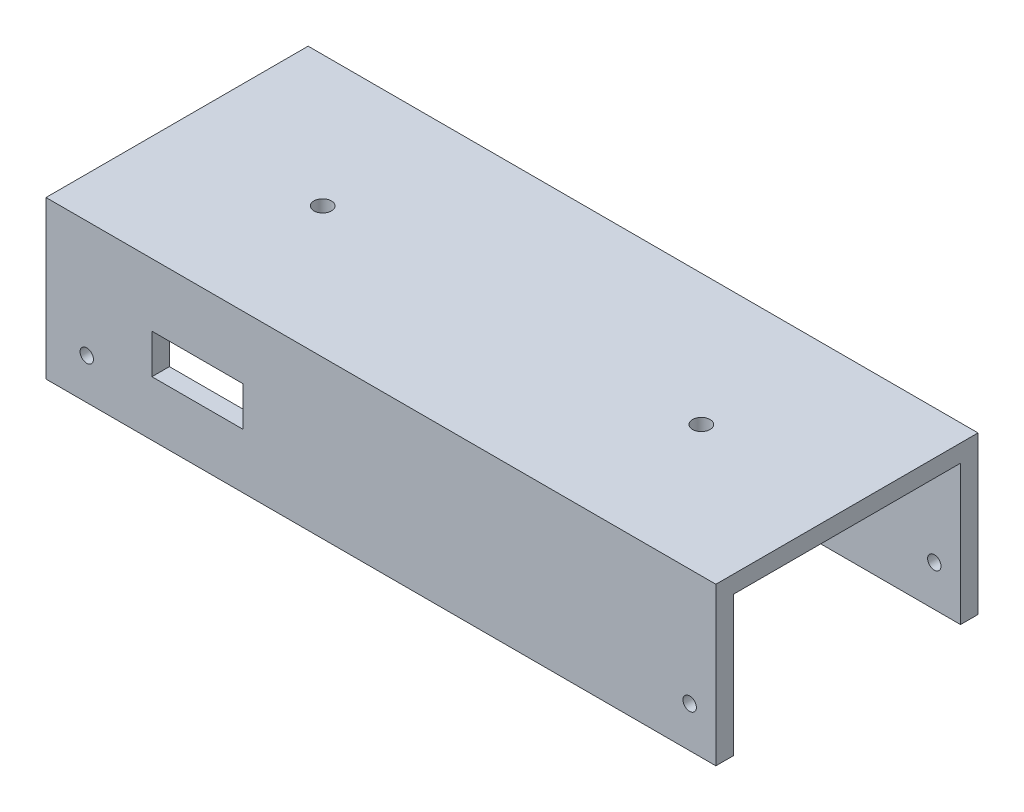
from build123d import *

# Parameters (mm, degrees)
SKETCH1_W           = 115
SKETCH1_H           = 27
BOSS_EXTRUDE5_DEPTH = 45
SHELL9_T            = -3
SKETCH3_R           = 1.15
CUT_EXTRUDE2_DEPTH  = 79
CUT_EXTRUDE8_DEPTH  = 23
SKETCH7_W           = 15.603868878
SKETCH7_H           = 6.773772537
CUT_EXTRUDE9_DEPTH  = 20
CUT_EXTRUDE10_DEPTH = 1
SKETCH10_R          = 1.5
CUT_EXTRUDE11_DEPTH = 26


with BuildPart() as part:
    # Sketch1 → Boss-Extrude5 (new body)
    with BuildSketch(Plane.XY):
        with Locations((57.5, 13.5)):
            Rectangle(SKETCH1_W, SKETCH1_H)
    extrude(amount=BOSS_EXTRUDE5_DEPTH)

    # Shell9
    shell9_openings = [part.faces().sort_by_distance(p)[0] for p in [
        (115, 13.5, 22.5),
        (57.5, 0, 22.5),
        (0, 13.5, 22.5),
    ]]
    offset(amount=SHELL9_T, openings=shell9_openings, kind=Kind.INTERSECTION)

    # Sketch3 → Cut-Extrude2 (cut)
    with BuildSketch(Plane(origin=(0, 0, 0), x_dir=(-1, 0, 0), z_dir=(0, 0, -1))):
        with Locations((-7, 7)):
            Circle(SKETCH3_R)
        with Locations((-110.5, 7)):
            Circle(SKETCH3_R)
    extrude(amount=-CUT_EXTRUDE2_DEPTH, mode=Mode.SUBTRACT)

    # Sketch6 → Cut-Extrude8 (cut)
    with BuildSketch(Plane(origin=(0, 0, 0), x_dir=(-1, 0, 0), z_dir=(0, 0, -1))):
        with BuildLine():
            Line((-46.883496676, 21.743762355), (-71.973496676, 21.743762355))
            ThreePointArc((-71.973496676, 21.743762355), (-73.723496676, 19.993762355), (-71.973496676, 18.243762355))
            Line((-71.973496676, 18.243762355), (-46.883496676, 18.243762355))
            ThreePointArc((-46.883496676, 18.243762355), (-45.133496676, 19.993762355), (-46.883496676, 21.743762355))
        make_face()
        with BuildLine():
            Line((-14.873496676, 15.993762355), (-89.873496676, 15.993762355))
            ThreePointArc((-89.873496676, 15.993762355), (-94.373496676, 11.493762355), (-89.873496676, 6.993762355))
            Line((-89.873496676, 6.993762355), (-14.873496676, 6.993762355))
            ThreePointArc((-14.873496676, 6.993762355), (-10.373496676, 11.493762355), (-14.873496676, 15.993762355))
        make_face()
        with BuildLine():
            ThreePointArc((-71.973496676, 4.743762355), (-73.723496676, 2.993762355), (-71.973496676, 1.243762355))
            Line((-71.973496676, 1.243762355), (-46.883496676, 1.243762355))
            ThreePointArc((-46.883496676, 1.243762355), (-45.133496676, 2.993762355), (-46.883496676, 4.743762355))
            Line((-46.883496676, 4.743762355), (-71.973496676, 4.743762355))
        make_face()
    extrude(amount=-CUT_EXTRUDE8_DEPTH, mode=Mode.SUBTRACT)

    # Sketch7 → Cut-Extrude9 (cut)
    with BuildSketch(Plane.XY.offset(45)):
        with Locations((25.989861683, 12.834718769)):
            Rectangle(SKETCH7_W, SKETCH7_H)
    extrude(amount=-CUT_EXTRUDE9_DEPTH, mode=Mode.SUBTRACT)

    # Sketch9 → Cut-Extrude10 (cut)
    # profile 1 of 6: a face of its own
    with BuildSketch(Plane.XZ.offset(-24)):
        with BuildLine():
            Line((2.360897436, 22.428821238), (2.645833333, 22.428821238))
            Line((2.645833333, 22.428821238), (2.645833333, 20.587550205))
            add(Edge.make_bspline(
                [(2.645833333, 20.587550205), (2.645582016, 20.54832753), (2.645096913, 20.472618319), (2.641603532, 20.363145879), (2.634236918, 20.262030216), (2.625883329, 20.168810167), (2.613866664, 20.083917824), (2.599192388, 20.007099874), (2.582650022, 19.9382826), (2.568117397, 19.895896494), (2.561242989, 19.875846479)],
                knots=[0, 0, 0, 0, 1.307562039, 2.523909702, 3.650326591, 4.686913197, 5.643429486, 6.506965704, 7.293745905, 8, 8, 8, 8], degree=3))
            add(Edge.make_bspline(
                [(2.561242989, 19.875846479), (2.551092751, 19.849784336), (2.53109576, 19.79843929), (2.493643793, 19.725655299), (2.451703037, 19.657123932), (2.403799771, 19.593227101), (2.350150613, 19.534285573), (2.292019545, 19.479018802), (2.228274443, 19.428596022), (2.158951754, 19.383887216), (2.085649501, 19.343621817), (2.008409823, 19.308745288), (1.927668268, 19.278367937), (1.842666359, 19.255614258), (1.754736789, 19.235897762), (1.662845548, 19.223066511), (1.567529511, 19.214333394), (1.502718345, 19.213525826), (1.469836739, 19.21311611)],
                knots=[0, 0, 0, 0, 0.981931301, 1.934503488, 2.87077864, 3.801706999, 4.735015492, 5.667491629, 6.616593066, 7.585388521, 8.561939025, 9.551802639, 10.560317337, 11.588439944, 12.640189604, 13.723962949, 14.845264515, 16, 16, 16, 16], degree=3))
            add(Edge.make_bspline(
                [(1.469836739, 19.21311611), (1.42186273, 19.213893065), (1.3281566, 19.215410667), (1.191536357, 19.233091711), (1.061783432, 19.258087464), (0.940612318, 19.295920245), (0.82878873, 19.342218085), (0.727076357, 19.395372079), (0.636388281, 19.45632238), (0.554633235, 19.525719354), (0.480844793, 19.608236408), (0.411423608, 19.705481074), (0.344602611, 19.818934609), (0.305442489, 19.902203713), (0.284935897, 19.945808418)],
                knots=[0, 0, 0, 0, 1.157897085, 2.2616841, 3.32207898, 4.345638746, 5.321241055, 6.241986252, 7.112515963, 7.955008012, 8.825025602, 9.77857164, 10.836726669, 12, 12, 12, 12], degree=3))
            Line((0.284935897, 19.945808418), (0.569871795, 19.945808418))
            add(Edge.make_bspline(
                [(0.569871795, 19.945808418), (0.592788228, 19.909426659), (0.637587032, 19.838304801), (0.721360297, 19.746217866), (0.813168893, 19.667520171), (0.916111177, 19.604101112), (1.030615479, 19.556285801), (1.156750687, 19.522199639), (1.295543201, 19.501792312), (1.392170438, 19.499332781), (1.442487981, 19.498052008)],
                knots=[0, 0, 0, 0, 0.997731894, 1.950442991, 2.880492273, 3.800895997, 4.748200782, 5.754801363, 6.83083817, 8, 8, 8, 8], degree=3))
            add(Edge.make_bspline(
                [(1.442487981, 19.498052008), (1.492169374, 19.499349357), (1.587950128, 19.501850516), (1.725682688, 19.522208747), (1.851408096, 19.556293219), (1.964401993, 19.604016541), (2.063331154, 19.662482267), (2.14861346, 19.72779662), (2.217687559, 19.801439387), (2.264145036, 19.869277168), (2.293023582, 19.929714772), (2.311413397, 19.981741769), (2.326357641, 20.040572594), (2.338857922, 20.106010012), (2.349172965, 20.178147515), (2.355707008, 20.257150045), (2.360429423, 20.342838054), (2.360737824, 20.402249687), (2.360897436, 20.432997921)],
                knots=[0, 0, 0, 0, 1.570740765, 3.028230971, 4.391408896, 5.680370741, 6.894727393, 8.017376726, 9.065722033, 10.075533815, 10.603371122, 11.180248986, 11.817768598, 12.521299649, 13.286540596, 14.121245857, 15.027658897, 16, 16, 16, 16], degree=3))
            Line((2.360897436, 20.432997921), (2.360897436, 20.553205253))
            add(Edge.make_bspline(
                [(2.360897436, 20.553205253), (2.331976708, 20.518786618), (2.274643959, 20.450554761), (2.175631741, 20.361145277), (2.067484967, 20.28414143), (1.950387754, 20.220987383), (1.82720842, 20.170476376), (1.699281111, 20.135149548), (1.567752604, 20.112325924), (1.478623868, 20.109870002), (1.433583734, 20.108628931)],
                knots=[0, 0, 0, 0, 1.012485704, 2.007162095, 2.997754123, 3.998611389, 4.999708251, 5.992315798, 6.98544096, 8, 8, 8, 8], degree=3))
            add(Edge.make_bspline(
                [(1.433583734, 20.108628931), (1.407062261, 20.109096133), (1.35433317, 20.110025009), (1.275997077, 20.1181519), (1.198816965, 20.129943617), (1.122972834, 20.147253208), (1.048355242, 20.169470703), (0.975087498, 20.197244458), (0.902576371, 20.228645316), (0.832139905, 20.265632073), (0.764479629, 20.306782166), (0.700105882, 20.351358159), (0.63935585, 20.399126749), (0.582807749, 20.450558973), (0.530535754, 20.505580392), (0.481836817, 20.563604473), (0.437516224, 20.625441445), (0.396664506, 20.689963757), (0.361233728, 20.757601166), (0.330132905, 20.82688701), (0.303091517, 20.89767314), (0.281532902, 20.970196547), (0.265067249, 21.044411509), (0.252811543, 21.120196444), (0.24586017, 21.197784725), (0.244776203, 21.25005552), (0.244230769, 21.276357296)],
                knots=[0, 0, 0, 0, 1.028754217, 2.045334182, 3.052854819, 4.056607503, 5.061168794, 6.071104265, 7.095078842, 8.125279047, 9.155117945, 10.165957491, 11.161587969, 12.151493252, 13.128948131, 14.104219989, 15.088194871, 16.07871515, 17.064853787, 18.047899887, 19.02414258, 20.002704429, 20.980574569, 21.971845993, 22.979467364, 24, 24, 24, 24], degree=3))
            add(Edge.make_bspline(
                [(0.244230769, 21.276357296), (0.244701727, 21.302667247), (0.245641819, 21.355185248), (0.253761636, 21.433090119), (0.265344208, 21.509951821), (0.283675541, 21.584978107), (0.305739544, 21.659023417), (0.333065927, 21.731540831), (0.365921516, 21.802552436), (0.403123218, 21.872110818), (0.444928073, 21.939282583), (0.490768252, 22.003078897), (0.540699095, 22.06303031), (0.594031762, 22.119741636), (0.651417453, 22.172665705), (0.712826482, 22.221674066), (0.777653523, 22.267588218), (0.846099493, 22.309417788), (0.917108266, 22.346413112), (0.988875801, 22.380170253), (1.062352772, 22.406961919), (1.136169289, 22.430568587), (1.211625355, 22.447291943), (1.287795776, 22.460193548), (1.364941326, 22.468053688), (1.416605737, 22.46903484), (1.442487981, 22.469526366)],
                knots=[0, 0, 0, 0, 1.008818848, 2.013730394, 3.001654427, 3.987803273, 4.973046549, 5.963777569, 6.957074694, 7.972068341, 8.987420212, 9.989399531, 10.982630087, 11.977756091, 12.973280677, 13.973972381, 14.989194003, 16.018387222, 17.047741039, 18.059210846, 19.057554164, 20.045176975, 21.029480261, 22.018708529, 23.007435371, 24, 24, 24, 24], degree=3))
            add(Edge.make_bspline(
                [(1.442487981, 22.469526366), (1.485169904, 22.46829567), (1.569453588, 22.465865423), (1.69348814, 22.446796241), (1.8131786, 22.416394243), (1.929200372, 22.372837207), (2.042498569, 22.313373958), (2.152699785, 22.235048569), (2.260122857, 22.137158475), (2.326414889, 22.062089805), (2.360897436, 22.023041991)],
                knots=[0, 0, 0, 0, 0.96728863, 1.910097829, 2.838038873, 3.762875196, 4.71315279, 5.730631239, 6.819562287, 8, 8, 8, 8], degree=3))
            Line((2.360897436, 22.023041991), (2.360897436, 22.428821238))
        make_face()
        with BuildLine():
            add(Edge.make_bspline(
                [(1.465384615, 22.184590469), (1.423718905, 22.18317436), (1.341229635, 22.180370763), (1.220318067, 22.156436059), (1.103589706, 22.118929421), (0.99327621, 22.06527862), (0.889946189, 21.999878847), (0.798256888, 21.920648729), (0.718060999, 21.830164679), (0.650222191, 21.729244812), (0.596218737, 21.620367462), (0.557988635, 21.505604153), (0.533268971, 21.386809267), (0.530540601, 21.305735549), (0.529166667, 21.264908979)],
                knots=[0, 0, 0, 0, 1.026226791, 2.031711442, 3.026614839, 4.04107745, 5.047145931, 6.032893242, 7.017642609, 8.019221815, 9.021877557, 10.003543541, 10.994637589, 12, 12, 12, 12], degree=3))
            add(Edge.make_bspline(
                [(0.529166667, 21.264908979), (0.529825032, 21.234126653), (0.531119843, 21.17358682), (0.543569089, 21.084743158), (0.563690393, 21.000124588), (0.59220843, 20.919725991), (0.627544089, 20.843086213), (0.671987169, 20.770733193), (0.724284836, 20.702602495), (0.784027757, 20.639198034), (0.849864903, 20.581448441), (0.921274462, 20.530704647), (0.998159582, 20.489202207), (1.078629331, 20.453333019), (1.164636231, 20.427135579), (1.254941473, 20.407143258), (1.350183941, 20.395705313), (1.415109733, 20.394287632), (1.448212139, 20.393564828)],
                knots=[0, 0, 0, 0, 1.039728707, 2.044842319, 3.024901384, 3.974314358, 4.923051295, 5.871625912, 6.837440708, 7.820715446, 8.810779094, 9.792721783, 10.773906224, 11.758876063, 12.764959493, 13.806266761, 14.881525401, 16, 16, 16, 16], degree=3))
            add(Edge.make_bspline(
                [(1.448212139, 20.393564828), (1.481743549, 20.394261159), (1.547313864, 20.395622827), (1.643081785, 20.407328144), (1.733825771, 20.426216651), (1.819462617, 20.453034538), (1.900315662, 20.487253555), (1.975476634, 20.530557486), (2.046557126, 20.579873792), (2.111287583, 20.637397548), (2.169820219, 20.700793222), (2.220829558, 20.769776806), (2.264294808, 20.843310276), (2.300288123, 20.921385346), (2.327766572, 21.004608766), (2.346198722, 21.092772489), (2.359086269, 21.185454131), (2.360284536, 21.248961947), (2.360897436, 21.281445437)],
                knots=[0, 0, 0, 0, 1.121943988, 2.193949579, 3.223793937, 4.220241907, 5.192961521, 6.155822191, 7.11847367, 8.083710714, 9.04790392, 10.001595906, 10.949595423, 11.902125208, 12.873731292, 13.87582262, 14.913508608, 16, 16, 16, 16], degree=3))
            add(Edge.make_bspline(
                [(2.360897436, 21.281445437), (2.359682256, 21.32373449), (2.357308222, 21.40635244), (2.334904372, 21.526736436), (2.298781753, 21.639919448), (2.24812077, 21.745543511), (2.184637091, 21.84248946), (2.10817325, 21.928961805), (2.020047922, 22.005071868), (1.920514302, 22.068479514), (1.813428406, 22.11970173), (1.701377035, 22.158129909), (1.584526545, 22.179896181), (1.505327159, 22.1830167), (1.465384615, 22.184590469)],
                knots=[0, 0, 0, 0, 1.070913519, 2.092188694, 3.091357305, 4.074328408, 5.051968682, 6.018948707, 6.99050112, 7.9935919, 9.000589572, 9.992915277, 10.987769056, 12, 12, 12, 12], degree=3))
        make_face(mode=Mode.SUBTRACT)
    # profile 2 of 6: a face of its own
    with BuildSketch(Plane.XZ.offset(-24)):
        with BuildLine():
            Line((3.215705128, 22.428821238), (3.500641026, 22.428821238))
            Line((3.500641026, 22.428821238), (3.500641026, 22.087279772))
            add(Edge.make_bspline(
                [(3.500641026, 22.087279772), (3.521676543, 22.119080416), (3.561906805, 22.179898901), (3.628774962, 22.260334624), (3.69726727, 22.326932559), (3.767711619, 22.380003609), (3.840626038, 22.419748366), (3.914410273, 22.448861334), (3.990225163, 22.46607647), (4.041172051, 22.468374861), (4.066696715, 22.469526366)],
                knots=[0, 0, 0, 0, 1.2804753, 2.448899062, 3.506932113, 4.484331642, 5.4025378, 6.288909075, 7.142734305, 8, 8, 8, 8], degree=3))
            add(Edge.make_bspline(
                [(4.066696715, 22.469526366), (4.086496311, 22.468446389), (4.127235267, 22.466224264), (4.188905188, 22.450611588), (4.252444605, 22.425685096), (4.293395199, 22.402244323), (4.31474359, 22.390024163)],
                knots=[0, 0, 0, 0, 0.901110191, 1.854092781, 2.881294221, 4, 4, 4, 4], degree=3))
            Line((4.31474359, 22.390024163), (4.158283253, 22.143249323))
            add(Edge.make_bspline(
                [(4.158283253, 22.143249323), (4.144577213, 22.149363707), (4.118560524, 22.160969979), (4.080501739, 22.174705946), (4.04541224, 22.182793955), (4.023057012, 22.184019249), (4.012635216, 22.184590469)],
                knots=[0, 0, 0, 0, 1.180555205, 2.24091978, 3.179933427, 4, 4, 4, 4], degree=3))
            add(Edge.make_bspline(
                [(4.012635216, 22.184590469), (3.989770015, 22.183066435), (3.943131633, 22.179957848), (3.874656408, 22.155520501), (3.808210729, 22.11603689), (3.755440721, 22.072248096), (3.714580963, 22.030022594), (3.685425187, 21.993148686), (3.658680124, 21.951802356), (3.63312571, 21.906690428), (3.609842714, 21.857042639), (3.588112407, 21.80335501), (3.568464724, 21.745565357), (3.557261289, 21.705304071), (3.551522436, 21.684680613)],
                knots=[0, 0, 0, 0, 1.125678352, 2.296057538, 3.5422874, 4.923748041, 5.663163013, 6.437101912, 7.23742474, 8.08941207, 8.991984279, 9.93940061, 10.944477711, 12, 12, 12, 12], degree=3))
            add(Edge.make_bspline(
                [(3.551522436, 21.684680613), (3.547229479, 21.66628632), (3.537720906, 21.625544358), (3.528475725, 21.557192482), (3.519341234, 21.476435306), (3.512903587, 21.38304804), (3.506936363, 21.277263894), (3.503570789, 21.158921715), (3.500755797, 21.027900032), (3.500680443, 20.936301869), (3.500641026, 20.888386543)],
                knots=[0, 0, 0, 0, 0.566838948, 1.255505196, 2.06880316, 3.007127437, 4.065329342, 5.249902469, 6.561414163, 8, 8, 8, 8], degree=3))
            Line((3.500641026, 20.888386543), (3.500641026, 20.108628931))
            Line((3.500641026, 20.108628931), (3.215705128, 20.108628931))
            Line((3.215705128, 20.108628931), (3.215705128, 22.428821238))
        make_face()
    # profile 3 of 6: a face of its own
    with BuildSketch(Plane.XZ.offset(-24)):
        with BuildLine():
            add(Edge.make_bspline(
                [(5.720342548, 22.469526366), (5.763877488, 22.468599365), (5.849238867, 22.466781742), (5.974250306, 22.447355309), (6.093580537, 22.417648772), (6.207686583, 22.376580997), (6.315107079, 22.321533799), (6.417406708, 22.255848228), (6.514304994, 22.178031161), (6.572383028, 22.117834913), (6.601862981, 22.087279772)],
                knots=[0, 0, 0, 0, 1.054011418, 2.066658804, 3.057071809, 4.030435133, 4.997543892, 5.974964718, 6.972108034, 8, 8, 8, 8], degree=3))
            add(Edge.make_bspline(
                [(6.601862981, 22.087279772), (6.627246611, 22.058057085), (6.677522627, 22.00017725), (6.741989386, 21.90632823), (6.797526087, 21.809136853), (6.842033202, 21.707312492), (6.877126045, 21.60174404), (6.902041355, 21.492068645), (6.916861289, 21.378528515), (6.918859694, 21.301417891), (6.919871795, 21.262364908)],
                knots=[0, 0, 0, 0, 1.025258237, 2.030674902, 3.01204498, 3.988269485, 4.97094183, 5.956517959, 6.965070386, 8, 8, 8, 8], degree=3))
            add(Edge.make_bspline(
                [(6.919871795, 21.262364908), (6.918981582, 21.22308557), (6.917222479, 21.145467766), (6.900582198, 21.031150199), (6.874700428, 20.920302038), (6.837660117, 20.813387366), (6.790163833, 20.710079373), (6.732205852, 20.610829281), (6.663379456, 20.515441275), (6.585361545, 20.424725322), (6.499135914, 20.341117398), (6.405594837, 20.268248182), (6.306576535, 20.205817228), (6.20076435, 20.155528479), (6.089124558, 20.115877537), (5.971416361, 20.088028236), (5.847822619, 20.071190138), (5.763433639, 20.069027896), (5.720342548, 20.067923802)],
                knots=[0, 0, 0, 0, 0.998656419, 1.973391657, 2.932242238, 3.890759089, 4.846373663, 5.82037756, 6.809684879, 7.83454468, 8.860553229, 9.859544525, 10.845671541, 11.83227036, 12.833544569, 13.85385346, 14.904124723, 16, 16, 16, 16], degree=3))
            add(Edge.make_bspline(
                [(5.720342548, 20.067923802), (5.677040338, 20.069031602), (5.592230773, 20.071201283), (5.468200775, 20.087962818), (5.35028162, 20.115864702), (5.238495677, 20.155658785), (5.132228566, 20.205818835), (5.03263653, 20.268059439), (4.939019464, 20.341139009), (4.852775592, 20.424719466), (4.774762571, 20.515442784), (4.705934914, 20.61082889), (4.647977261, 20.710079475), (4.60048089, 20.813387339), (4.563440603, 20.920302045), (4.537558826, 21.031150197), (4.520918547, 21.145467767), (4.519159444, 21.22308557), (4.518269231, 21.262364908)],
                knots=[0, 0, 0, 0, 1.099876186, 2.154163076, 3.173186993, 4.173200201, 5.163417411, 6.152872554, 7.150605724, 8.17532212, 9.198891216, 10.186952605, 11.159729845, 12.11414092, 13.071450619, 14.029093627, 15.002601286, 16, 16, 16, 16], degree=3))
            add(Edge.make_bspline(
                [(4.518269231, 21.262364908), (4.519288234, 21.301205632), (4.521305684, 21.37810359), (4.536110718, 21.491430281), (4.560928837, 21.600920055), (4.596063746, 21.706081022), (4.640981098, 21.807459168), (4.695737409, 21.904890693), (4.760861769, 21.998315341), (4.810937825, 22.056120371), (4.836278045, 22.085371719)],
                knots=[0, 0, 0, 0, 1.031353054, 2.041901799, 3.029428768, 4.008703097, 4.981709435, 5.96992636, 6.972712378, 8, 8, 8, 8], degree=3))
            add(Edge.make_bspline(
                [(4.836278045, 22.085371719), (4.865713552, 22.116191843), (4.923603658, 22.176805038), (5.020984289, 22.254395257), (5.123032255, 22.321447695), (5.231639867, 22.375401119), (5.345652174, 22.417890346), (5.465593915, 22.44743192), (5.591029561, 22.466711749), (5.676808646, 22.468578811), (5.720342548, 22.469526366)],
                knots=[0, 0, 0, 0, 1.027980169, 2.021703884, 2.998553061, 3.971491411, 4.943284454, 5.930300938, 6.949603206, 8, 8, 8, 8], degree=3))
        make_face()
        with BuildLine():
            add(Edge.make_bspline(
                [(5.719070513, 22.184590469), (5.688284251, 22.183715447), (5.62750647, 22.18198799), (5.538044418, 22.16884902), (5.451920136, 22.148032355), (5.368970227, 22.118455818), (5.289474421, 22.080266103), (5.213356606, 22.033359233), (5.140392892, 21.97835648), (5.072010592, 21.915343914), (5.009252352, 21.846510826), (4.954390187, 21.773169814), (4.907740269, 21.696510486), (4.868878125, 21.616453123), (4.839933747, 21.532186433), (4.818912506, 21.444664718), (4.80578593, 21.353709661), (4.804074715, 21.291877881), (4.803205128, 21.260456855)],
                knots=[0, 0, 0, 0, 1.021534396, 2.016698045, 2.994645724, 3.958388632, 4.93408049, 5.916473867, 6.921342795, 7.962252576, 8.998418191, 10.008913653, 10.997312074, 11.973003931, 12.956656626, 13.948281152, 14.957379055, 16, 16, 16, 16], degree=3))
            add(Edge.make_bspline(
                [(4.803205128, 21.260456855), (4.804662747, 21.219860373), (4.807555847, 21.139283948), (4.831082812, 21.020619573), (4.870440365, 20.906698893), (4.923587398, 20.798189743), (4.990177325, 20.697794176), (5.06863345, 20.608285044), (5.158113749, 20.531009343), (5.257551574, 20.466891719), (5.364915848, 20.415946798), (5.478541225, 20.379843442), (5.597050998, 20.356374121), (5.678041375, 20.354041426), (5.719070513, 20.3528597)],
                knots=[0, 0, 0, 0, 1.016792936, 2.018143844, 3.017858371, 4.030088057, 5.03801393, 6.028138512, 7.003788237, 7.991172063, 8.984598303, 9.972568034, 10.972917682, 12, 12, 12, 12], degree=3))
            add(Edge.make_bspline(
                [(5.719070513, 20.3528597), (5.76009729, 20.354048311), (5.84108301, 20.356394597), (5.95942812, 20.379725241), (6.072742937, 20.41610499), (6.179995696, 20.466834423), (6.279388258, 20.531252828), (6.369512103, 20.607848684), (6.447298344, 20.69803125), (6.513822399, 20.798322722), (6.567839802, 20.90653067), (6.607013135, 21.020640599), (6.630596659, 21.139278594), (6.633482125, 21.219858579), (6.634935897, 21.260456855)],
                knots=[0, 0, 0, 0, 1.02726834, 2.027799167, 3.010890988, 4.004497153, 4.992059811, 5.971914811, 6.958719428, 7.966827853, 8.981595046, 9.981490638, 10.983022906, 12, 12, 12, 12], degree=3))
            add(Edge.make_bspline(
                [(6.634935897, 21.260456855), (6.63406661, 21.291878068), (6.632355984, 21.353710219), (6.619225123, 21.444662587), (6.598219741, 21.53219425), (6.569216917, 21.616424282), (6.530523633, 21.696717768), (6.482974113, 21.772944734), (6.428335969, 21.846764887), (6.364820438, 21.915121404), (6.296509516, 21.978381044), (6.223516232, 22.033380562), (6.147511287, 22.080059952), (6.06824643, 22.11878247), (5.985285886, 22.147763272), (5.899282276, 22.168969216), (5.810201927, 22.181932466), (5.749641938, 22.183698801), (5.719070513, 22.184590469)],
                knots=[0, 0, 0, 0, 1.042956736, 2.052379634, 3.044323526, 4.02829302, 5.004299113, 5.996692471, 7.007513377, 8.048758398, 9.090003419, 10.095195979, 11.07790575, 12.047570684, 13.018257071, 13.989683339, 14.985167495, 16, 16, 16, 16], degree=3))
        make_face(mode=Mode.SUBTRACT)
    # profile 4 of 6: a face of its own
    with BuildSketch(Plane.XZ.offset(-24)):
        with BuildLine():
            Line((7.449038462, 22.428821238), (7.733974359, 22.428821238))
            Line((7.733974359, 22.428821238), (7.733974359, 21.352679411))
            add(Edge.make_bspline(
                [(7.733974359, 21.352679411), (7.734103087, 21.321090203), (7.734349338, 21.260661528), (7.736019334, 21.17370718), (7.739947348, 21.094407733), (7.74485846, 21.022717379), (7.751174112, 20.958648245), (7.758688303, 20.902424114), (7.767087014, 20.85340739), (7.77530819, 20.823885917), (7.779131611, 20.810156375)],
                knots=[0, 0, 0, 0, 1.388932606, 2.656963016, 3.823490214, 4.879454478, 5.816252168, 6.653371382, 7.373723809, 8, 8, 8, 8], degree=3))
            add(Edge.make_bspline(
                [(7.779131611, 20.810156375), (7.785265216, 20.792899913), (7.797404911, 20.758745748), (7.819424429, 20.70940715), (7.84666442, 20.663709572), (7.876472978, 20.619890878), (7.910853155, 20.579249075), (7.949369961, 20.541852797), (7.990734076, 20.506289086), (8.052197561, 20.464211453), (8.136252752, 20.419112547), (8.246609181, 20.380199911), (8.366265157, 20.35694456), (8.448964581, 20.354246486), (8.491471354, 20.3528597)],
                knots=[0, 0, 0, 0, 0.725840625, 1.436591201, 2.137033971, 2.831655856, 3.53531722, 4.242432219, 4.957935707, 5.694543706, 7.190802206, 8.724350549, 10.316345118, 12, 12, 12, 12], degree=3))
            add(Edge.make_bspline(
                [(8.491471354, 20.3528597), (8.533974179, 20.354275975), (8.616209281, 20.357016206), (8.734550575, 20.379498416), (8.842728643, 20.417059291), (8.939657721, 20.469498872), (9.024898161, 20.533672029), (9.095931455, 20.608972877), (9.154539465, 20.693019107), (9.180129439, 20.755724702), (9.192998798, 20.78725974)],
                knots=[0, 0, 0, 0, 1.157059328, 2.238695713, 3.266970494, 4.264342957, 5.228770407, 6.160125903, 7.074715775, 8, 8, 8, 8], degree=3))
            add(Edge.make_bspline(
                [(9.192998798, 20.78725974), (9.196803564, 20.799929168), (9.205214972, 20.827938179), (9.214252248, 20.875454094), (9.222393367, 20.932118414), (9.229344962, 20.998301932), (9.234302645, 21.073831691), (9.236975112, 21.158684089), (9.239994334, 21.252592751), (9.240040159, 21.318331362), (9.240064103, 21.352679411)],
                knots=[0, 0, 0, 0, 0.557542046, 1.232589297, 2.036731608, 2.971723315, 4.038036528, 5.22795436, 6.551621927, 8, 8, 8, 8], degree=3))
            Line((9.240064103, 21.352679411), (9.240064103, 22.428821238))
            Line((9.240064103, 22.428821238), (9.525, 22.428821238))
            Line((9.525, 22.428821238), (9.525, 21.299253931))
            add(Edge.make_bspline(
                [(9.525, 21.299253931), (9.52459932, 21.260875282), (9.523821945, 21.186415454), (9.518825998, 21.078207725), (9.510253849, 20.977367688), (9.497242985, 20.883841967), (9.481943409, 20.797701966), (9.462207361, 20.718837283), (9.438641388, 20.647490902), (9.4120571, 20.582410861), (9.38065012, 20.523404036), (9.347242751, 20.467400831), (9.308666708, 20.415790811), (9.26805371, 20.366004872), (9.222876494, 20.320519344), (9.173981622, 20.278290505), (9.122057291, 20.238672826), (9.065951233, 20.203211451), (9.006482518, 20.171264923), (8.943577734, 20.142947481), (8.8764664, 20.120538715), (8.806014386, 20.101206896), (8.731876522, 20.086044485), (8.65412428, 20.075352385), (8.572783849, 20.068797978), (8.517348839, 20.068220087), (8.488927284, 20.067923802)],
                knots=[0, 0, 0, 0, 1.493040784, 2.896703357, 4.213163133, 5.428574705, 6.569057535, 7.615249723, 8.588095153, 9.490268104, 10.346124644, 11.18633936, 12.024365274, 12.850166724, 13.684164916, 14.514361689, 15.362232829, 16.222528818, 17.093394965, 17.986930858, 18.902426812, 19.842810585, 20.827885679, 21.843828298, 22.894529745, 24, 24, 24, 24], degree=3))
            add(Edge.make_bspline(
                [(8.488927284, 20.067923802), (8.460718303, 20.068231965), (8.40528503, 20.068837534), (8.323940401, 20.075316174), (8.245972737, 20.086027872), (8.171659233, 20.101317962), (8.100925315, 20.120403404), (8.033484469, 20.143085182), (7.97012638, 20.171279619), (7.910089847, 20.203009261), (7.853844824, 20.238900618), (7.801132042, 20.278241625), (7.752022183, 20.320973554), (7.706504414, 20.366917942), (7.665217643, 20.416644734), (7.627647376, 20.469753921), (7.593215222, 20.525719273), (7.562052334, 20.585647999), (7.535280956, 20.651481179), (7.511645125, 20.724322117), (7.492313332, 20.8049694), (7.476581236, 20.893354078), (7.463925286, 20.989053152), (7.455138571, 21.092620214), (7.450225639, 21.203802992), (7.449442719, 21.280592535), (7.449038462, 21.320242512)],
                knots=[0, 0, 0, 0, 1.083640291, 2.129454052, 3.13281866, 4.105697902, 5.042300162, 5.946461698, 6.836384745, 7.703652036, 8.553297018, 9.397182691, 10.228592656, 11.052265423, 11.879314572, 12.708807002, 13.549817954, 14.402308542, 15.300838682, 16.27712199, 17.341985831, 18.484375296, 19.725102775, 21.0496083, 22.476576903, 24, 24, 24, 24], degree=3))
            Line((7.449038462, 21.320242512), (7.449038462, 22.428821238))
        make_face()
    # profile 5 of 6: a face of its own
    with BuildSketch(Plane.XZ.offset(-24)):
        with BuildLine():
            Line((10.176282051, 22.428821238), (10.461217949, 22.428821238))
            Line((10.461217949, 22.428821238), (10.461217949, 21.999509339))
            add(Edge.make_bspline(
                [(10.461217949, 21.999509339), (10.491477952, 22.038459998), (10.550282213, 22.114152808), (10.651632662, 22.212115282), (10.758609125, 22.294733593), (10.873964506, 22.359487748), (10.995905996, 22.408310913), (11.12393317, 22.444396557), (11.259132621, 22.465661323), (11.35156726, 22.468220973), (11.398707933, 22.469526366)],
                knots=[0, 0, 0, 0, 1.0828784, 2.104357462, 3.088488658, 4.04616522, 5.001424249, 5.969181776, 6.964304535, 8, 8, 8, 8], degree=3))
            add(Edge.make_bspline(
                [(11.398707933, 22.469526366), (11.439884601, 22.468335126), (11.52127245, 22.465980576), (11.641072665, 22.450039305), (11.756438906, 22.422718255), (11.866718497, 22.383347425), (11.973092849, 22.334674248), (12.073987183, 22.273245223), (12.170973051, 22.202119607), (12.261611308, 22.120266156), (12.345359977, 22.031703372), (12.41779187, 21.936433139), (12.480268526, 21.837588507), (12.530769438, 21.733637109), (12.570328439, 21.625397522), (12.598463182, 21.512432436), (12.615206902, 21.39516069), (12.617453397, 21.315420365), (12.618589744, 21.275085261)],
                knots=[0, 0, 0, 0, 1.041296284, 2.058176809, 3.050446431, 4.034000596, 5.01514041, 6.003636468, 7.015969324, 8.052561599, 9.08815499, 10.094063707, 11.074456064, 12.040834395, 13.011057502, 13.983766392, 14.980127149, 16, 16, 16, 16], degree=3))
            add(Edge.make_bspline(
                [(12.618589744, 21.275085261), (12.617478053, 21.233898881), (12.615285639, 21.152673396), (12.598281241, 21.033395815), (12.571106076, 20.918653697), (12.532046153, 20.808637894), (12.481571374, 20.703424153), (12.420153666, 20.603088351), (12.347685228, 20.507662635), (12.264862062, 20.418442504), (12.175006899, 20.336255984), (12.078960891, 20.264375735), (11.978214579, 20.204013202), (11.873283399, 20.153591517), (11.76326907, 20.115589322), (11.648684882, 20.08817746), (11.529593221, 20.07127331), (11.448584319, 20.069048867), (11.407612179, 20.067923802)],
                knots=[0, 0, 0, 0, 1.038740735, 2.04854663, 3.033179607, 4.009277356, 4.987731542, 5.972001279, 6.972200261, 8.005528982, 9.039189865, 10.040446548, 11.026516639, 11.997840187, 12.972163198, 13.956796175, 14.96660207, 16, 16, 16, 16], degree=3))
            add(Edge.make_bspline(
                [(11.407612179, 20.067923802), (11.361504311, 20.069098378), (11.270427752, 20.071418509), (11.137261294, 20.094931117), (11.009103007, 20.130071051), (10.887372759, 20.181505138), (10.771106243, 20.247051213), (10.660961133, 20.326979757), (10.556352365, 20.42112361), (10.493388706, 20.492544615), (10.461217949, 20.529036583)],
                knots=[0, 0, 0, 0, 1.014726462, 2.004382257, 2.969841629, 3.936926163, 4.907207904, 5.903978561, 6.929055279, 8, 8, 8, 8], degree=3))
            Line((10.461217949, 20.529036583), (10.461217949, 19.253821238))
            Line((10.461217949, 19.253821238), (10.176282051, 19.253821238))
            Line((10.176282051, 19.253821238), (10.176282051, 22.428821238))
        make_face()
        with BuildLine():
            add(Edge.make_bspline(
                [(11.396163862, 22.184590469), (11.363888116, 22.184009663), (11.300345492, 22.182866207), (11.207207122, 22.169282696), (11.117494841, 22.149563459), (11.032112785, 22.119707664), (10.950242583, 22.083060169), (10.872514805, 22.037265773), (10.798984011, 21.983152882), (10.729835205, 21.921758049), (10.66736636, 21.854108153), (10.612064276, 21.781910641), (10.565611935, 21.705256943), (10.52705653, 21.624861078), (10.497716553, 21.540092855), (10.476892435, 21.451435051), (10.463802044, 21.358790626), (10.462088508, 21.295693392), (10.461217949, 21.263636943)],
                knots=[0, 0, 0, 0, 1.05670511, 2.080379991, 3.077984906, 4.06214886, 5.038337365, 6.01289324, 7.01187578, 8.025460281, 9.038092164, 10.024533457, 11.000252242, 11.969694649, 12.940728589, 13.933144304, 14.949937299, 16, 16, 16, 16], degree=3))
            add(Edge.make_bspline(
                [(10.461217949, 21.263636943), (10.462661082, 21.221556298), (10.465488304, 21.139116751), (10.488472916, 21.018662583), (10.525879191, 20.904678582), (10.578973096, 20.798124641), (10.64605411, 20.700168783), (10.726878866, 20.61245659), (10.820716037, 20.535539411), (10.926005561, 20.470750131), (11.038874208, 20.418146671), (11.156608571, 20.380487351), (11.27758957, 20.357289687), (11.359385117, 20.354344358), (11.400615986, 20.3528597)],
                knots=[0, 0, 0, 0, 1.03728447, 2.032128127, 3.01272805, 3.987917167, 4.958271349, 5.931593992, 6.91984656, 7.941419022, 8.973179163, 9.983609215, 10.983593296, 12, 12, 12, 12], degree=3))
            add(Edge.make_bspline(
                [(11.400615986, 20.3528597), (11.441016289, 20.354271556), (11.521203629, 20.357073837), (11.63927564, 20.381329193), (11.754020719, 20.418381465), (11.863041304, 20.472410491), (11.965388325, 20.538622901), (12.057809448, 20.618052359), (12.138551434, 20.710118237), (12.207371242, 20.812633093), (12.262826232, 20.922556476), (12.304491521, 21.036295308), (12.328538584, 21.153448656), (12.331946528, 21.232368009), (12.333653846, 21.271905173)],
                knots=[0, 0, 0, 0, 1.00104056, 1.986885549, 2.97790532, 3.984399681, 4.995088187, 5.994304198, 6.996462723, 8.023150851, 9.048424203, 10.043036403, 11.019596776, 12, 12, 12, 12], degree=3))
            add(Edge.make_bspline(
                [(12.333653846, 21.271905173), (12.332334195, 21.311687913), (12.329705173, 21.390943445), (12.303808932, 21.507749793), (12.264892524, 21.621948171), (12.208142527, 21.730370384), (12.140831375, 21.832672588), (12.059418028, 21.922982178), (11.968144764, 22.002058431), (11.865919594, 22.067386696), (11.756209351, 22.119352823), (11.640716534, 22.157347267), (11.52002698, 22.180183454), (11.437814751, 22.183108542), (11.396163862, 22.184590469)],
                knots=[0, 0, 0, 0, 0.983928682, 1.960191568, 2.949917689, 3.96440592, 4.982380491, 5.975291189, 6.965713506, 7.964880129, 8.970154049, 9.96478489, 10.968906225, 12, 12, 12, 12], degree=3))
        make_face(mode=Mode.SUBTRACT)
    # profile 6 of 6: a face of its own
    with BuildSketch(Plane.XZ.offset(-24)):
        with BuildLine():
            Line((14.613141026, 22.550936623), (14.328205128, 22.550936623))
            add(Edge.make_bspline(
                [(14.328205128, 22.550936623), (14.335924506, 22.582897519), (14.351015259, 22.645378457), (14.382490915, 22.734647901), (14.416780239, 22.819124238), (14.457954641, 22.897225676), (14.502866154, 22.970521824), (14.554321766, 23.037350244), (14.609947514, 23.099410577), (14.671474432, 23.154486157), (14.73599829, 23.204358811), (14.804428266, 23.246881184), (14.875387606, 23.283460952), (14.949367948, 23.313596448), (15.026589546, 23.336298173), (15.106354276, 23.352768989), (15.188871165, 23.363465214), (15.244885051, 23.364509121), (15.273327324, 23.365039187)],
                knots=[0, 0, 0, 0, 1.162005537, 2.271625781, 3.343758855, 4.383309926, 5.390229558, 6.379919256, 7.361854164, 8.333198761, 9.295911338, 10.242430842, 11.177959212, 12.116337295, 13.062827104, 14.020064771, 14.994644689, 16, 16, 16, 16], degree=3))
            add(Edge.make_bspline(
                [(15.273327324, 23.365039187), (15.314768097, 23.363788028), (15.3967457, 23.361313002), (15.517180749, 23.338712049), (15.633319364, 23.302947822), (15.743890324, 23.253532369), (15.846595617, 23.192583878), (15.937977729, 23.120044438), (16.016798021, 23.037313643), (16.082923635, 22.945934817), (16.134698813, 22.84827589), (16.172877166, 22.747764319), (16.196119691, 22.644638531), (16.19913191, 22.575008713), (16.200641026, 22.540124323)],
                knots=[0, 0, 0, 0, 1.083050992, 2.142477498, 3.193116406, 4.255571735, 5.30263384, 6.308962982, 7.297363603, 8.282367274, 9.249857812, 10.179914175, 11.08814088, 12, 12, 12, 12], degree=3))
            add(Edge.make_bspline(
                [(16.200641026, 22.540124323), (16.199585482, 22.506553874), (16.197519948, 22.440861714), (16.179981515, 22.344957213), (16.150466477, 22.254568047), (16.109581763, 22.169313707), (16.056657643, 22.089734745), (15.992547411, 22.015652115), (15.916798567, 21.946737236), (15.859395531, 21.907258857), (15.829842748, 21.886934219)],
                knots=[0, 0, 0, 0, 1.024540389, 2.004866551, 2.965041327, 3.920577974, 4.882998113, 5.874504559, 6.905732034, 8, 8, 8, 8], degree=3))
            add(Edge.make_bspline(
                [(15.829842748, 21.886934219), (15.863617269, 21.870625449), (15.930534362, 21.838313059), (16.021748056, 21.774943908), (16.104550129, 21.701777078), (16.150727074, 21.6446791), (16.173928285, 21.615990709)],
                knots=[0, 0, 0, 0, 1.015518401, 2.012035669, 3.001164323, 4, 4, 4, 4], degree=3))
            add(Edge.make_bspline(
                [(16.173928285, 21.615990709), (16.189205789, 21.595074035), (16.219510616, 21.55358321), (16.256917136, 21.486875167), (16.290852547, 21.419427745), (16.31729596, 21.349433141), (16.337773682, 21.277702621), (16.352411368, 21.204113019), (16.361504696, 21.128604241), (16.362806947, 21.077520777), (16.363461538, 21.051843073)],
                knots=[0, 0, 0, 0, 1.025084078, 2.033381695, 3.024893161, 4.013698104, 4.991890475, 5.976764909, 6.982997093, 8, 8, 8, 8], degree=3))
            add(Edge.make_bspline(
                [(16.363461538, 21.051843073), (16.361833658, 21.007384255), (16.358585559, 20.918675842), (16.329553292, 20.78761663), (16.284546995, 20.659504924), (16.220632488, 20.536972749), (16.142738391, 20.422327689), (16.050067104, 20.319751323), (15.943671577, 20.231578303), (15.825012167, 20.157909025), (15.696454486, 20.099019195), (15.55895377, 20.058145658), (15.414491221, 20.031524644), (15.315424601, 20.028669984), (15.265059095, 20.027218674)],
                knots=[0, 0, 0, 0, 0.955779014, 1.907060117, 2.875433937, 3.871313158, 4.872415639, 5.851225146, 6.836215519, 7.83643374, 8.849228613, 9.86973379, 10.916971861, 12, 12, 12, 12], degree=3))
            add(Edge.make_bspline(
                [(15.265059095, 20.027218674), (15.231114444, 20.028006268), (15.16432269, 20.029555989), (15.066130373, 20.040150149), (14.972402832, 20.05949951), (14.883013339, 20.085537509), (14.797882485, 20.118550018), (14.717270047, 20.159660551), (14.640680072, 20.208021699), (14.568835309, 20.264204311), (14.501744323, 20.327052384), (14.441190066, 20.397681628), (14.386162968, 20.474786416), (14.338136431, 20.559262331), (14.29492291, 20.650017672), (14.259380185, 20.748214524), (14.228096848, 20.85297503), (14.213552205, 20.925979837), (14.206089744, 20.963436623)],
                knots=[0, 0, 0, 0, 1.048658725, 2.063410685, 3.046034179, 4.001477787, 4.936774919, 5.862367409, 6.792675028, 7.730719943, 8.675894397, 9.627829632, 10.600096036, 11.597688215, 12.626045268, 13.701542398, 14.82072376, 16, 16, 16, 16], degree=3))
            Line((14.206089744, 20.963436623), (14.491025641, 20.963436623))
            add(Edge.make_bspline(
                [(14.491025641, 20.963436623), (14.498449055, 20.938990018), (14.512888241, 20.891439248), (14.53746664, 20.823004114), (14.565468573, 20.76026788), (14.595508208, 20.702770333), (14.627057227, 20.649945225), (14.662358623, 20.603189387), (14.698797776, 20.560449168), (14.726265475, 20.536369413), (14.739708534, 20.524584459)],
                knots=[0, 0, 0, 0, 1.198163088, 2.33053128, 3.407730985, 4.417276592, 5.372219308, 6.28897303, 7.162600585, 8, 8, 8, 8], degree=3))
            add(Edge.make_bspline(
                [(14.739708534, 20.524584459), (14.757485428, 20.510879042), (14.792984344, 20.483510513), (14.850831239, 20.448584036), (14.911668671, 20.41832082), (14.97681484, 20.395203468), (15.044863953, 20.375629447), (15.11691592, 20.362820119), (15.192335067, 20.354031563), (15.243831539, 20.353256018), (15.270147236, 20.3528597)],
                knots=[0, 0, 0, 0, 0.946170439, 1.889420265, 2.845303464, 3.807233317, 4.801018734, 5.828864929, 6.890507805, 8, 8, 8, 8], degree=3))
            add(Edge.make_bspline(
                [(15.270147236, 20.3528597), (15.299859342, 20.353418414), (15.3579588, 20.354510931), (15.442735708, 20.364558179), (15.523387464, 20.379190769), (15.599018618, 20.401790403), (15.670619864, 20.429713033), (15.737187503, 20.464772658), (15.7995954, 20.505906798), (15.857044217, 20.552660177), (15.908701928, 20.603842534), (15.954185629, 20.65737582), (15.992852286, 20.713034322), (16.024043104, 20.771126046), (16.048672531, 20.831410432), (16.065439435, 20.894056656), (16.077097595, 20.958552033), (16.078047022, 21.002393312), (16.078525641, 21.024494315)],
                knots=[0, 0, 0, 0, 1.217147791, 2.380027433, 3.494444702, 4.572153297, 5.609568379, 6.639424714, 7.649109417, 8.668170816, 9.669597737, 10.625200337, 11.543417969, 12.441394052, 13.322311151, 14.205496177, 15.095365482, 16, 16, 16, 16], degree=3))
            add(Edge.make_bspline(
                [(16.078525641, 21.024494315), (16.077137439, 21.054077458), (16.074367942, 21.113096543), (16.053223731, 21.199926057), (16.018444904, 21.283585867), (15.969756269, 21.362648619), (15.910487429, 21.435923901), (15.841213549, 21.501303032), (15.761359371, 21.5552509), (15.687862775, 21.592524181), (15.622761526, 21.617957814), (15.567048999, 21.634898674), (15.504676937, 21.649243919), (15.436399607, 21.662590051), (15.361702546, 21.673948703), (15.280667077, 21.683420921), (15.193276779, 21.691000137), (15.132778364, 21.694384773), (15.101602564, 21.696128931)],
                knots=[0, 0, 0, 0, 1.07054697, 2.135767047, 3.216561865, 4.33974944, 5.486079747, 6.621378074, 7.775625952, 8.963672916, 9.598146892, 10.304877434, 11.070270905, 11.915000392, 12.823868403, 13.805723172, 14.86925407, 16, 16, 16, 16], degree=3))
            Line((15.101602564, 21.696128931), (15.101602564, 22.021769956))
            add(Edge.make_bspline(
                [(15.101602564, 22.021769956), (15.140882907, 22.022436528), (15.21782345, 22.023742179), (15.330213284, 22.039533731), (15.437685503, 22.061378301), (15.537858333, 22.09483844), (15.629161094, 22.133700709), (15.708372448, 22.178923785), (15.774382646, 22.229192879), (15.826870903, 22.285283889), (15.866358132, 22.34544111), (15.895229584, 22.408139793), (15.912284166, 22.473929476), (15.914560792, 22.518828211), (15.915705128, 22.541396358)],
                knots=[0, 0, 0, 0, 1.321986639, 2.589447074, 3.816329219, 5.01088745, 6.139805852, 7.153945165, 8.075214402, 8.924034688, 9.728124013, 10.488707548, 11.240355623, 12, 12, 12, 12], degree=3))
            add(Edge.make_bspline(
                [(15.915705128, 22.541396358), (15.915329198, 22.557976884), (15.914581303, 22.590963054), (15.905149487, 22.639155081), (15.89097625, 22.685873796), (15.871491067, 22.730920524), (15.84541053, 22.773982844), (15.814199385, 22.815427887), (15.777035465, 22.855019029), (15.734449238, 22.891921891), (15.688718529, 22.927091127), (15.638599091, 22.956948498), (15.585602104, 22.98248009), (15.529668896, 23.003534424), (15.470617951, 23.019372493), (15.408726716, 23.030744292), (15.343877175, 23.037854164), (15.299634246, 23.038877799), (15.277143429, 23.039398161)],
                knots=[0, 0, 0, 0, 0.884392785, 1.759457502, 2.611959086, 3.489218968, 4.37281399, 5.2945488, 6.255912374, 7.266815255, 8.301784654, 9.332968512, 10.37626691, 11.440494194, 12.520033166, 13.637162961, 14.798855837, 16, 16, 16, 16], degree=3))
            add(Edge.make_bspline(
                [(15.277143429, 23.039398161), (15.240992274, 23.038135997), (15.170380658, 23.035670697), (15.068585697, 23.014077964), (14.973953159, 22.979626416), (14.901618797, 22.938502892), (14.84820389, 22.897907855), (14.810034096, 22.862454548), (14.772550491, 22.823054772), (14.738219055, 22.777281817), (14.703499091, 22.728235515), (14.671890095, 22.673422603), (14.641174517, 22.614272903), (14.62266649, 22.572457577), (14.613141026, 22.550936623)],
                knots=[0, 0, 0, 0, 1.472543308, 2.876219568, 4.221790263, 5.565193594, 6.249813518, 6.953379497, 7.687249741, 8.463570142, 9.283606569, 10.136032583, 11.040678096, 12, 12, 12, 12], degree=3))
        make_face()
    extrude(amount=-CUT_EXTRUDE10_DEPTH, mode=Mode.SUBTRACT)

    # Sketch10 → Cut-Extrude11 (cut)
    with BuildSketch(Plane.XZ.offset(-24)):
        with Locations((25, 22.5)):
            Circle(SKETCH10_R)
        with Locations((90, 22.5)):
            Circle(SKETCH10_R)
    extrude(amount=-CUT_EXTRUDE11_DEPTH, mode=Mode.SUBTRACT)


solid = part.part
